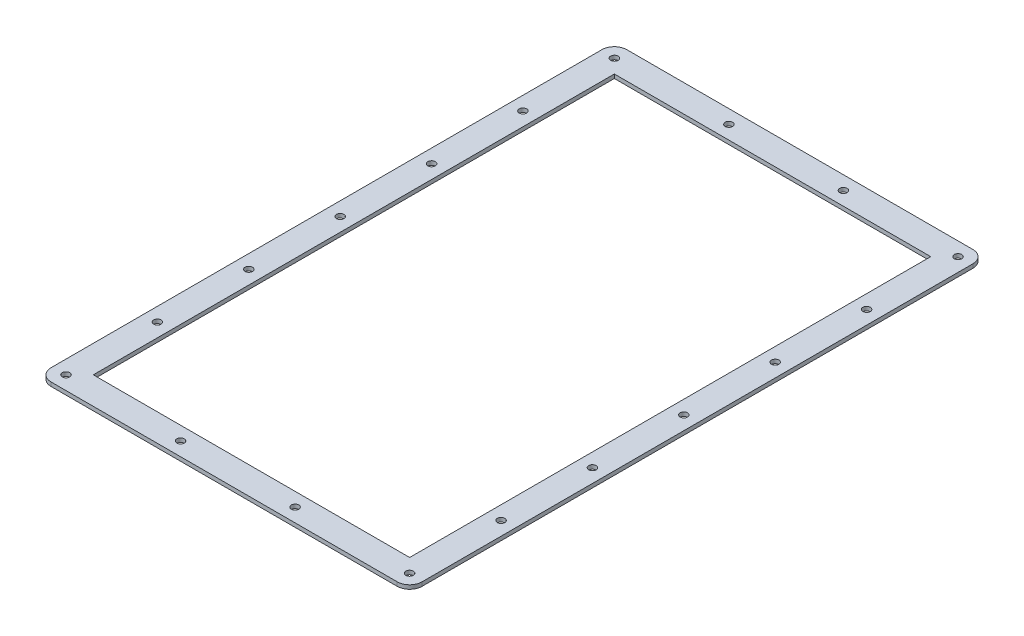
from build123d import *

# Parameters (mm, degrees)
SKETCH1_W           = 299
SKETCH1_H           = 464
SKETCH1_R           = 3
SKETCH1_W_2         = 255
SKETCH1_H_2         = 420
BOSS_EXTRUDE1_DEPTH = 3.175
FILLET1_R           = 10


with BuildPart() as part:
    # Sketch1 → Boss-Extrude1 (new body)
    with BuildSketch(Plane(origin=(0, 0, 0), x_dir=(1, 0, 0), z_dir=(0, 1, 0))):
        with Locations((2.5, -40)):
            Rectangle(SKETCH1_W, SKETCH1_H)
        with Locations((-136, -261)):
            Circle(SKETCH1_R, mode=Mode.SUBTRACT)
        with Locations((-136, -187.333333333)):
            Circle(SKETCH1_R, mode=Mode.SUBTRACT)
        with Locations((-43.666666667, -261)):
            Circle(SKETCH1_R, mode=Mode.SUBTRACT)
        with Locations((-136, -113.666666667)):
            Circle(SKETCH1_R, mode=Mode.SUBTRACT)
        with Locations((-136, -40)):
            Circle(SKETCH1_R, mode=Mode.SUBTRACT)
        with Locations((48.666666667, -261)):
            Circle(SKETCH1_R, mode=Mode.SUBTRACT)
        with Locations((141, -261)):
            Circle(SKETCH1_R, mode=Mode.SUBTRACT)
        with Locations((141, -187.333333333)):
            Circle(SKETCH1_R, mode=Mode.SUBTRACT)
        with Locations((141, -113.666666667)):
            Circle(SKETCH1_R, mode=Mode.SUBTRACT)
        with Locations((-136, 33.666666667)):
            Circle(SKETCH1_R, mode=Mode.SUBTRACT)
        with Locations((2.5, -40)):
            Rectangle(SKETCH1_W_2, SKETCH1_H_2, mode=Mode.SUBTRACT)
        with Locations((-136, 107.333333333)):
            Circle(SKETCH1_R, mode=Mode.SUBTRACT)
        with Locations((-136, 181)):
            Circle(SKETCH1_R, mode=Mode.SUBTRACT)
        with Locations((-43.666666667, 181)):
            Circle(SKETCH1_R, mode=Mode.SUBTRACT)
        with Locations((141, -40)):
            Circle(SKETCH1_R, mode=Mode.SUBTRACT)
        with Locations((141, 33.666666667)):
            Circle(SKETCH1_R, mode=Mode.SUBTRACT)
        with Locations((48.666666667, 181)):
            Circle(SKETCH1_R, mode=Mode.SUBTRACT)
        with Locations((141, 107.333333333)):
            Circle(SKETCH1_R, mode=Mode.SUBTRACT)
        with Locations((141, 181)):
            Circle(SKETCH1_R, mode=Mode.SUBTRACT)
    extrude(amount=BOSS_EXTRUDE1_DEPTH)

    # Fillet1
    fillet1_edges = [part.edges().sort_by_distance(p)[0] for p in [
        (152, 1.5875, 272),
        (-147, 1.5875, 272),
        (152, 1.5875, -192),
        (-147, 1.5875, -192),
    ]]
    fillet(fillet1_edges, radius=FILLET1_R)


solid = part.part
